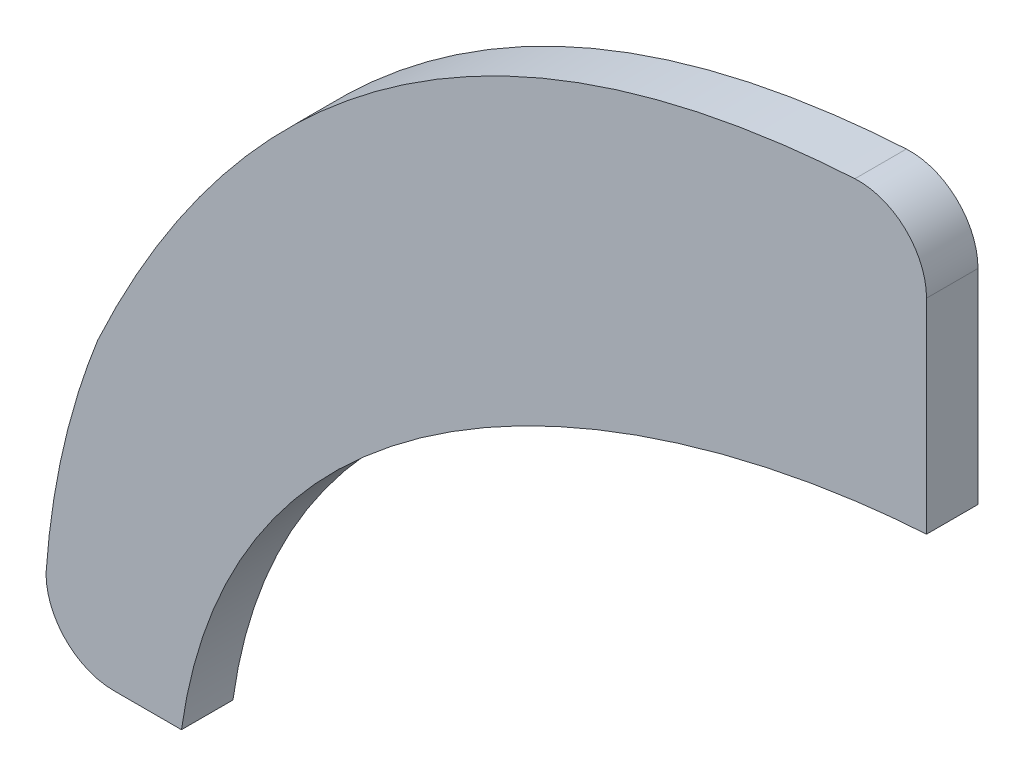
from build123d import *

# Parameters (mm, degrees)
BOSS_EXTRUDE1_DEPTH = 4.826


with BuildPart() as part:
    # Sketch1 → Boss-Extrude1 (new body)
    with BuildSketch(Plane.XY):
        with BuildLine():
            Line((82.55, 57.15), (82.55, 69.965076011))
            ThreePointArc((82.55, 69.965076011), (80.558857551, 74.582744345), (75.834138315, 76.304527503))
            add(Edge.make_bspline(
                [(34.595623521, 63.5), (46.218670952, 71.084635598), (60.024913941, 75.392147391), (75.834138315, 76.304527503)],
                knots=[0.485890457, 0.485890457, 0.485890457, 0.485890457, 0.937258984, 0.937258984, 0.937258984, 0.937258984], degree=3))
            add(Edge.make_bspline(
                [(4.874159463, 27.760276097), (12.101522434, 43.372959487), (22.083612854, 55.33527022), (34.595623521, 63.5)],
                knots=[0, 0, 0, 0, 0.485890457, 0.485890457, 0.485890457, 0.485890457], degree=3))
            add(Edge.make_bspline(
                [(0, 6.35), (0.772778777, 17.469645346), (4.874159463, 27.760276097)],
                knots=[0, 0, 0, 1, 1, 1], degree=2))
            ThreePointArc((0, 6.35), (1.859871939, 1.859871939), (6.35, 0))
            Line((6.35, 0), (12.7, 0))
            add(Edge.make_bspline(
                [(12.7, 0), (17.263490099, 32.946390999), (53.333433175, 49.033191713), (82.55, 50.8)],
                knots=[0, 0, 0, 0, 1, 1, 1, 1], degree=3))
            Line((82.55, 50.8), (82.55, 57.15))
        make_face()
    extrude(amount=BOSS_EXTRUDE1_DEPTH)


solid = part.part
